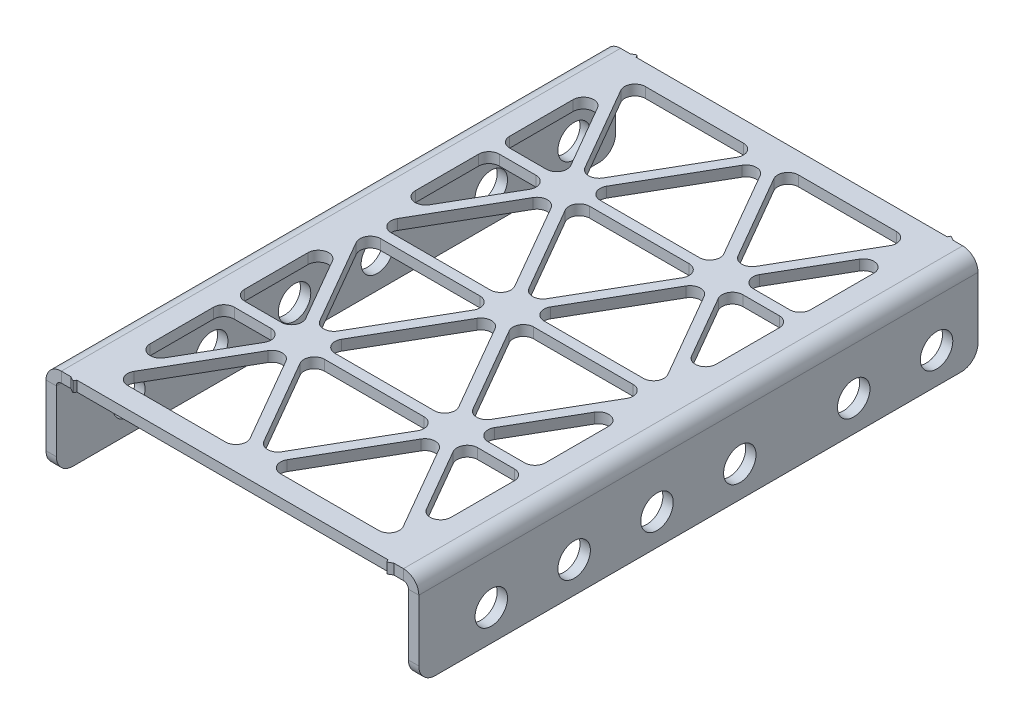
from build123d import *

# Parameters (mm, degrees)
BASE_FLANGE1_DEPTH      = 85.725
CUT_EXTRUDE1_DEPTH      = 91.710033382
CUT_EXTRUDE1_DEPTH_BACK = 91.710033382
SKETCH6_R               = 2.4892
CUT_EXTRUDE2_DEPTH      = 91.710033382
CUT_EXTRUDE2_DEPTH_BACK = 91.710033382
SKETCH8_R               = 2.4892
SKETCH9_W               = 46.101
SKETCH9_H               = 79.375
CUT_EXTRUDE3_DEPTH      = 92.484637542
SKETCH10_W              = 46.101
SKETCH10_H              = 1.5875
EXTRUDE_THIN1_DEPTH     = 1.5875
FILLET5_R               = 1.5875
FILLET6_R               = 2.54


# Sheet-metal steps are written as plain solids
with BuildPart() as part:
    # Sketch1 → Base-Flange1 (new body)
    with BuildSketch(Plane.XY):
        with BuildLine():
            Line((-26.9875, -6.35), (-26.9875, 5.588))
            ThreePointArc((-26.9875, 5.588), (-26.764315367, 6.126815367), (-26.2255, 6.35))
            Line((-26.2255, 6.35), (26.2255, 6.35))
            ThreePointArc((26.2255, 6.35), (26.764315367, 6.126815367), (26.9875, 5.588))
            Line((26.9875, 5.588), (26.9875, -6.35))
            Line((26.9875, -6.35), (28.575, -6.35))
            Line((28.575, -6.35), (28.575, 5.588))
            ThreePointArc((28.575, 5.588), (27.886847382, 7.249347382), (26.2255, 7.9375))
            Line((26.2255, 7.9375), (-26.2255, 7.9375))
            ThreePointArc((-26.2255, 7.9375), (-27.886847382, 7.249347382), (-28.575, 5.588))
            Line((-28.575, 5.588), (-28.575, -6.35))
            Line((-28.575, -6.35), (-26.9875, -6.35))
        make_face()
    extrude(amount=BASE_FLANGE1_DEPTH)

    # Sketch6 → Cut-Extrude1 (cut, two sides: drawn at the far end of the back side and taken through both)
    with BuildSketch(Plane(origin=(0, 0, 0), x_dir=(0, 0, -1), z_dir=(1, 0, 0)).offset(-CUT_EXTRUDE1_DEPTH_BACK)):
        with Locations((-36.5125, -1.5875)):
            Circle(SKETCH6_R)
        with Locations((-49.2125, -1.5875)):
            Circle(SKETCH6_R)
        with Locations((-61.9125, -1.5875)):
            Circle(SKETCH6_R)
        with Locations((-74.6125, -1.5875)):
            Circle(SKETCH6_R)
    extrude(amount=CUT_EXTRUDE1_DEPTH + CUT_EXTRUDE1_DEPTH_BACK, mode=Mode.SUBTRACT)

    # Sketch8 → Cut-Extrude2 (cut, two sides: drawn at the far end of the back side and taken through both)
    with BuildSketch(Plane(origin=(0, 0, 0), x_dir=(0, 0, -1), z_dir=(1, 0, 0)).offset(-CUT_EXTRUDE2_DEPTH_BACK)):
        with Locations((-19.05, -1.5875)):
            Circle(SKETCH8_R)
        with Locations((-6.35, -1.5875)):
            Circle(SKETCH8_R)
    extrude(amount=CUT_EXTRUDE2_DEPTH + CUT_EXTRUDE2_DEPTH_BACK, mode=Mode.SUBTRACT)

    # Sketch9 → Cut-Extrude3 (cut, through all)
    with BuildSketch(Plane(origin=(0, 7.9375, 0), x_dir=(1, 0, 0), z_dir=(0, 1, 0))):
        with Locations((0, -42.8625)):
            Rectangle(SKETCH9_W, SKETCH9_H)
    extrude(amount=-CUT_EXTRUDE3_DEPTH, mode=Mode.SUBTRACT)

    # Sketch10 → Extrude-Thin1 (add)
    with BuildSketch(Plane(origin=(0, 7.9375, 0), x_dir=(1, 0, 0), z_dir=(0, 1, 0))):
        with Locations((0, -63.1825)):
            Rectangle(SKETCH10_W, SKETCH10_H)
        with Locations((0, -22.5425)):
            Rectangle(SKETCH10_W, SKETCH10_H)
        Polygon((25.434083577, -44.688125), (0, -0.635), (-25.434083577, -44.688125), (-24.059268249, -45.481875), (0, -3.81), (24.059268249, -45.481875), align=None)
        Polygon((-25.434083577, -41.036875), (0, -85.09), (25.434083577, -41.036875), (24.059268249, -40.243125), (0, -81.915), (-24.059268249, -40.243125), align=None)
        Polygon((-25.434083577, -0.396875), (24.059268249, -86.121875), (25.434083577, -85.328125), (-24.059268249, 0.396875), align=None)
        with Locations((0, -42.8625)):
            Rectangle(SKETCH10_W, SKETCH10_H)
        Polygon((24.059268249, 0.396875), (-25.434083577, -85.328125), (-24.059268249, -86.121875), (25.434083577, -0.396875), align=None)
    extrude(amount=-EXTRUDE_THIN1_DEPTH)

    # Fillet5
    fillet5_edges = [part.edges().sort_by_distance(p)[0] for p in [
        (21.997045256, 7.14375, 3.175),
        (-1.466469684, 7.14375, 3.175),
        (-21.997045256, 7.14375, 3.175),
        (1.466469684, 7.14375, 3.175),
        (-23.0505, 7.14375, 4.52536286),
        (-23.0505, 7.14375, 40.55963714),
        (-23.0505, 7.14375, 45.16536286),
        (-23.0505, 7.14375, 81.19963714),
        (1.466469684, 7.14375, 82.55),
        (21.997045256, 7.14375, 82.55),
        (-1.466469684, 7.14375, 82.55),
        (-21.997045256, 7.14375, 82.55),
        (23.0505, 7.14375, 4.52536286),
        (23.0505, 7.14375, 45.16536286),
        (23.0505, 7.14375, 81.19963714),
        (23.0505, 7.14375, 40.55963714),
        (13.106572798, 7.14375, 63.97625),
        (13.106572798, 7.14375, 62.38875),
        (13.106572798, 7.14375, 21.74875),
        (-11.73175747, 7.14375, 64.77),
        (11.73175747, 7.14375, 64.77),
        (-13.106572798, 7.14375, 63.97625),
        (-13.106572798, 7.14375, 62.38875),
        (-13.106572798, 7.14375, 21.74875),
        (11.73175747, 7.14375, 20.955),
        (-11.73175747, 7.14375, 20.955),
        (11.73175747, 7.14375, 24.13),
        (0, 7.14375, 3.81),
        (-23.0505, 7.14375, 63.97625),
        (-23.0505, 7.14375, 62.38875),
        (-10.356942141, 7.14375, 63.97625),
        (-22.088699611, 7.14375, 43.65625),
        (-23.0505, 7.14375, 23.33625),
        (-13.106572798, 7.14375, 23.33625),
        (10.356942141, 7.14375, 63.97625),
        (0, 7.14375, 81.915),
        (-11.73175747, 7.14375, 61.595),
        (-1.374815329, 7.14375, 43.65625),
        (-23.0505, 7.14375, 21.74875),
        (-22.088699611, 7.14375, 42.06875),
        (-10.356942141, 7.14375, 62.38875),
        (0, 7.14375, 44.45),
        (-1.374815329, 7.14375, 42.06875),
        (-11.73175747, 7.14375, 24.13),
        (23.0505, 7.14375, 63.97625),
        (10.356942141, 7.14375, 62.38875),
        (23.0505, 7.14375, 62.38875),
        (-10.356942141, 7.14375, 23.33625),
        (1.374815329, 7.14375, 43.65625),
        (0, 7.14375, 41.275),
        (10.356942141, 7.14375, 23.33625),
        (11.73175747, 7.14375, 61.595),
        (22.088699611, 7.14375, 43.65625),
        (22.088699611, 7.14375, 42.06875),
        (1.374815329, 7.14375, 42.06875),
        (10.356942141, 7.14375, 21.74875),
        (-10.356942141, 7.14375, 21.74875),
        (13.106572798, 7.14375, 23.33625),
        (23.0505, 7.14375, 23.33625),
        (23.0505, 7.14375, 21.74875),
    ]]
    fillet(fillet5_edges, radius=FILLET5_R)

    # Fillet6
    fillet6_edges = [part.edges().sort_by_distance(p)[0] for p in [
        (27.78125, -6.35, 0),
        (-27.78125, -6.35, 0),
        (27.78125, -6.35, 85.725),
        (-27.78125, -6.35, 85.725),
    ]]
    fillet(fillet6_edges, radius=FILLET6_R)


solid = part.part
